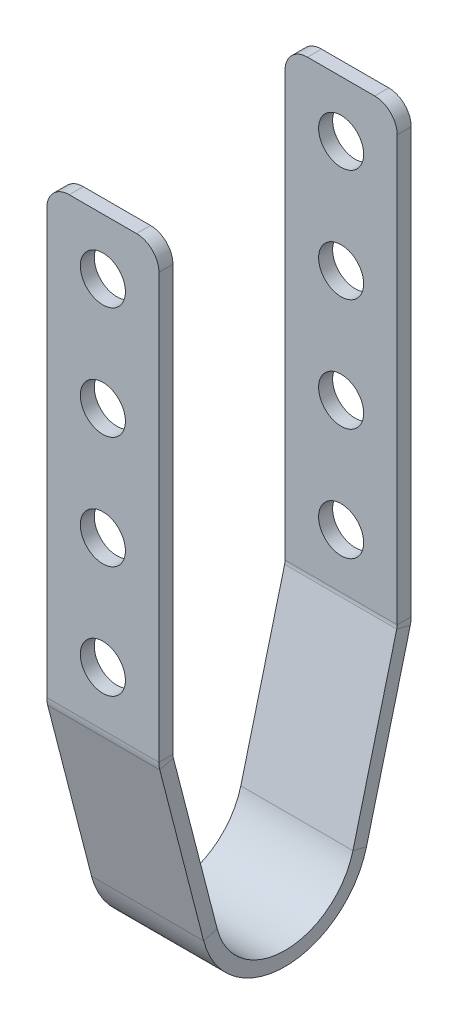
from build123d import *

# Parameters (mm, degrees)
BASE_FLANGE1_DEPTH     = 6.35
F_10_CLEARANCE_HOLE1_D = 5.1054
FILLET1_R              = 2.54


# Sheet-metal steps are written as plain solids
with BuildPart() as part:
    # Sketch1 → Base-Flange1 (new, symmetric)
    with BuildSketch(Plane(origin=(0, 0, 0), x_dir=(0, 0, -1), z_dir=(1, 0, 0))):
        with BuildLine():
            Line((0, 0), (0, -50.59861822))
            ThreePointArc((0, -50.59861822), (0.012620988, -50.798398969), (0.050283273, -50.995003112))
            Line((0.050283273, -50.995003112), (5.013916363, -70.244424463))
            ThreePointArc((5.013916363, -70.244424463), (12.7, -76.2), (20.386083637, -70.244424463))
            Line((20.386083637, -70.244424463), (25.349716727, -50.995003112))
            ThreePointArc((25.349716727, -50.995003112), (25.387379012, -50.798398969), (25.4, -50.59861822))
            Line((25.4, -50.59861822), (25.4, 0))
            Line((25.4, 0), (26.9875, 0))
            Line((26.9875, 0), (26.9875, -50.59861822))
            ThreePointArc((26.9875, -50.59861822), (26.962258024, -50.998179718), (26.886933455, -51.391388005))
            Line((26.886933455, -51.391388005), (21.923300364, -70.640809356))
            ThreePointArc((21.923300364, -70.640809356), (12.7, -77.7875), (3.476699636, -70.640809356))
            Line((3.476699636, -70.640809356), (-1.486933455, -51.391388005))
            ThreePointArc((-1.486933455, -51.391388005), (-1.562258024, -50.998179718), (-1.5875, -50.59861822))
            Line((-1.5875, -50.59861822), (-1.5875, 0))
            Line((-1.5875, 0), (0, 0))
        make_face()
    extrude(amount=BASE_FLANGE1_DEPTH, both=True)

    # #10 Clearance Hole1 (through all)
    with Locations(Plane.XY.offset(1.5875)):
        with Locations((0, -6.35), (0, -19.05), (0, -31.75), (0, -44.45)):
            Hole(F_10_CLEARANCE_HOLE1_D / 2)

    # Fillet1
    fillet1_edges = [part.edges().sort_by_distance(p)[0] for p in [
        (-6.35, 0, 0.79375),
        (-6.35, 0, -26.19375),
        (6.35, 0, 0.79375),
        (6.35, 0, -26.19375),
    ]]
    fillet(fillet1_edges, radius=FILLET1_R)


solid = part.part
